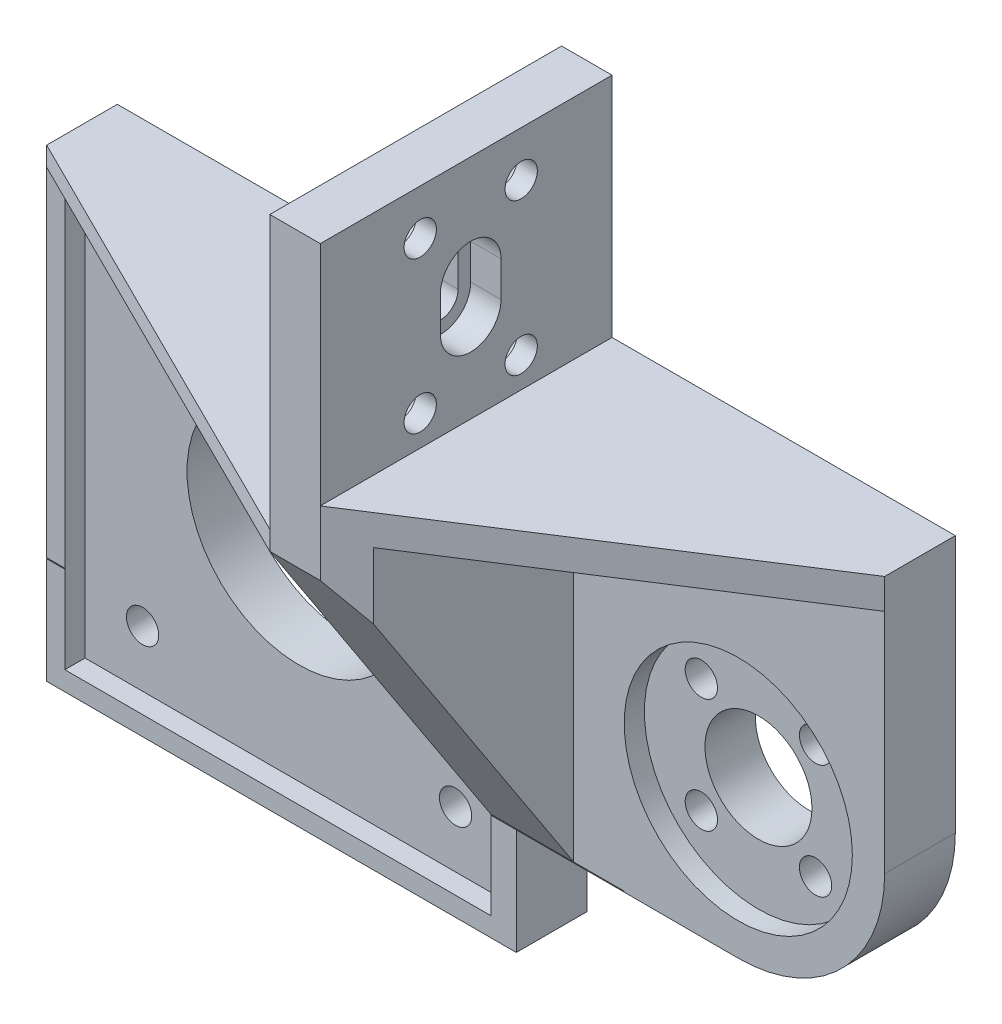
from build123d import *

# Parameters (mm, degrees)
SKETCH_1_R               = 5.3
SKETCH_1_R_2             = 11.1
EXTRUDE_1_DEPTH          = 7
SKETCH_2_R               = 11.3
SKETCH_2_W               = 42.2
SKETCH_2_H               = 42.2
CUT_EXTRUDE_1_DEPTH      = 2
SKETCH_3_R               = 1.6
CUT_EXTRUDE_2_DEPTH      = 99.783854956
EXTRUDE_2_DEPTH          = 21.9
CUT_EXTRUDE_3_DEPTH      = 96.645438992
CUT_EXTRUDE_4_DEPTH      = 89.767730623
CUT_EXTRUDE_4_DEPTH_BACK = 10
CUT_EXTRUDE_5_DEPTH      = 102.058695816
SKETCH_8_R               = 1.6
SKETCH_8_W               = 41.679602286
SKETCH_8_H               = 26.376779249
CUT_EXTRUDE_6_DEPTH      = 89.386707145
SKETCH_9_R               = 3
CUT_EXTRUDE_7_DEPTH      = 3
CUT_EXTRUDE_8_DEPTH      = 3
SKETCH_11_W              = 44
SKETCH_11_H              = 5
CUT_EXTRUDE_9_DEPTH      = 89.495536611
SKETCH_12_W              = 37.71360908
SKETCH_12_H              = 40.060480483
CUT_EXTRUDE_11_DEPTH     = 5
SKETCH_13_W              = 8.835151958
SKETCH_13_H              = 10.520362882
CUT_EXTRUDE_12_DEPTH     = 87.463055694


with BuildPart() as part:
    # 草图1 → 凸台-拉伸1 (new body)
    with BuildSketch(Plane.XY):
        Polygon((-68.5, 26), (-24.5, 26), (-24.5, 71), (-19.5, 71), (-19.5, 26), (-19.5, 25.5), (14.5, 25.5), (14.5, -25), (-68.5, -25), align=None)
        Circle(SKETCH_1_R, mode=Mode.SUBTRACT)
        with Locations((-45.5, -2)):
            Circle(SKETCH_1_R_2, mode=Mode.SUBTRACT)
    extrude(amount=EXTRUDE_1_DEPTH)

    # 草图2 → 切除-拉伸1 (cut)
    with BuildSketch(Plane.XY.offset(7)):
        Circle(SKETCH_2_R)
        with Locations((-45.6, -2)):
            Rectangle(SKETCH_2_W, SKETCH_2_H)
    extrude(amount=-CUT_EXTRUDE_1_DEPTH, mode=Mode.SUBTRACT)

    # 草图3 → 切除-拉伸2 (cut, through all)
    with BuildSketch(Plane.XY.offset(5)):
        with Locations((-61, 13.5)):
            Circle(SKETCH_3_R)
        with Locations((-30, 13.5)):
            Circle(SKETCH_3_R)
        with Locations((-30, -17.5)):
            Circle(SKETCH_3_R)
        with Locations((-61, -17.5)):
            Circle(SKETCH_3_R)
        with Locations((5.656854249, 5.656854249)):
            Circle(SKETCH_3_R)
        with Locations((-5.656854249, 5.656854249)):
            Circle(SKETCH_3_R)
        with Locations((5.656854249, -5.656854249)):
            Circle(SKETCH_3_R)
        with Locations((-5.656854249, -5.656854249)):
            Circle(SKETCH_3_R)
    extrude(amount=-CUT_EXTRUDE_2_DEPTH, mode=Mode.SUBTRACT)

    # 草图4 → 凸台-拉伸2 (add)
    with BuildSketch(Plane.XY.offset(7)):
        Polygon((-19.5, 68.4214033), (-24.5, 71), (-24.5, 26), (-68.5, 26), (-68.5, 19.1), (-66.7, 19.1), (-24.5, 19.1), (-24.5, -14.479637118), (-11.3, -14.479637118), (-11.3, 22.5), (14.5, 22.5), (14.5, 25.5), (-19.5, 25.5), align=None)
    extrude(amount=EXTRUDE_2_DEPTH)

    # 草图5 → 切除-拉伸3 (cut, through all)
    with BuildSketch(Plane(origin=(-11.3, 0, 0), x_dir=(0, 0, -1), z_dir=(1, 0, 0))):
        Polygon((-28.9, 19.1), (-28.9, -14.479637118), (-7, -14.479637118), (-6.982294127, -14.420838609), align=None)
    extrude(amount=-CUT_EXTRUDE_3_DEPTH, mode=Mode.SUBTRACT)

    # 草图6 → 切除-拉伸4 (cut, two sides: drawn at the far end of the back side and taken through both)
    with BuildSketch(Plane.XZ.offset(-22.5).offset(-CUT_EXTRUDE_4_DEPTH_BACK)):
        Polygon((-68.5, 28.9), (-68.5, 7), (-24.5, 28.9), align=None)
        Polygon((-19.5, 28.9), (14.5, 7), (14.5, 28.9), align=None)
    extrude(amount=CUT_EXTRUDE_4_DEPTH + CUT_EXTRUDE_4_DEPTH_BACK, mode=Mode.SUBTRACT)

    # 草图7 → 切除-拉伸5 (cut, through all)
    with BuildSketch(Plane.XY.offset(7)):
        with BuildLine():
            Line((-13.15, -14.479637118), (-11.3, -14.479637118))
            Line((-11.3, -14.479637118), (-0.0261596, -14.499976403))
            ThreePointArc((-0.0261596, -14.499976403), (10.243795337, -10.262292975), (14.5, 0))
            Line((14.5, 0), (21.147002499, 0))
            Line((21.147002499, 0), (22.768629324, -44.459429771))
            Line((22.768629324, -44.459429771), (-13.15, -44.459429771))
            Line((-13.15, -44.459429771), (-13.15, -14.479637118))
        make_face()
    extrude(amount=-CUT_EXTRUDE_5_DEPTH, mode=Mode.SUBTRACT)

    # 草图8 → 切除-拉伸6 (cut, through all)
    with BuildSketch(Plane.ZY.offset(24.5)):
        with Locations((19, 28.5)):
            Circle(SKETCH_8_R)
        with Locations((19, 43.5)):
            Circle(SKETCH_8_R)
        with Locations((9, 28.5)):
            Circle(SKETCH_8_R)
        with Locations((9, 43.5)):
            Circle(SKETCH_8_R)
        with Locations((14.868313548, 61.188389625)):
            Rectangle(SKETCH_8_W, SKETCH_8_H)
        with BuildLine():
            Line((15.75, 37.75), (15.75, 34.25))
            ThreePointArc((15.75, 34.25), (14, 32.5), (12.25, 34.25))
            Line((12.25, 34.25), (12.25, 37.75))
            ThreePointArc((12.25, 37.75), (14, 39.5), (15.75, 37.75))
        make_face()
    extrude(amount=-CUT_EXTRUDE_6_DEPTH, mode=Mode.SUBTRACT)

    # 草图9 → 切除-拉伸7 (cut)
    with BuildSketch(Plane.ZY.offset(24.5)):
        with Locations((9, 43.5)):
            Circle(SKETCH_9_R)
        with Locations((19, 43.5)):
            Circle(SKETCH_9_R)
        with Locations((9, 28.5)):
            Circle(SKETCH_9_R)
        with Locations((19, 28.5)):
            Circle(SKETCH_9_R)
    extrude(amount=-CUT_EXTRUDE_7_DEPTH, mode=Mode.SUBTRACT)

    # 草图10 → 切除-拉伸8 (cut)
    with BuildSketch(Plane(origin=(-19.5, 0, 0), x_dir=(0, 0, -1), z_dir=(1, 0, 0))):
        with BuildLine():
            Line((-11, 37.75), (-11, 34.25))
            ThreePointArc((-11, 34.25), (-14, 31.25), (-17, 34.25))
            Line((-17, 34.25), (-17, 37.75))
            ThreePointArc((-17, 37.75), (-14, 40.75), (-11, 37.75))
        make_face()
    extrude(amount=-CUT_EXTRUDE_8_DEPTH, mode=Mode.SUBTRACT)

    # 草图11 → 切除-拉伸9 (cut, through all)
    with BuildSketch(Plane(origin=(0, 0, 0), x_dir=(-1, 0, 0), z_dir=(0, 0, -1))):
        with Locations((46.5, 23.5)):
            Rectangle(SKETCH_11_W, SKETCH_11_H)
    extrude(amount=-CUT_EXTRUDE_9_DEPTH, mode=Mode.SUBTRACT)

    # 草图12 → 切除-拉伸11 (cut)
    with BuildSketch(Plane(origin=(-11.3, 0, 0), x_dir=(0, 0, -1), z_dir=(1, 0, 0))):
        with Locations((-25.85680454, 2.469759758)):
            Rectangle(SKETCH_12_W, SKETCH_12_H)
    extrude(amount=-CUT_EXTRUDE_11_DEPTH, mode=Mode.SUBTRACT)

    # 草图13 → 切除-拉伸12 (cut, through all)
    with BuildSketch(Plane.XY.offset(7)):
        with Locations((-17.567575979, -19.739818559)):
            Rectangle(SKETCH_13_W, SKETCH_13_H)
    extrude(amount=-CUT_EXTRUDE_12_DEPTH, mode=Mode.SUBTRACT)


solid = part.part
